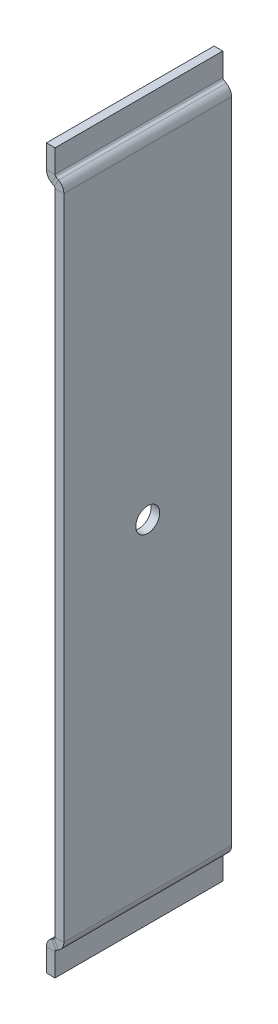
from build123d import *

# Parameters (mm, degrees)
BASE_FLANGE1_DEPTH = 44.45
CUT_EXTRUDE3_REACH = 107.213
SKETCH5_R          = 3.175


# Sheet-metal steps are written as plain solids
with BuildPart() as part:
    # Sketch1 → Base-Flange1 (new body)
    with BuildSketch(Plane.XY):
        with BuildLine():
            Line((-2.3368, 95.25), (-2.3368, 89.163964543))
            ThreePointArc((-2.3368, 89.163964543), (-1.962474978, 87.766964543), (-0.9398, 86.744289565))
            Line((-0.9398, 86.744289565), (-0.254, 86.34834275))
            ThreePointArc((-0.254, 86.34834275), (-0.068059095, 86.162401845), (0, 85.908401845))
            Line((0, 85.908401845), (0, -85.908401845))
            ThreePointArc((0, -85.908401845), (-0.068059095, -86.162401845), (-0.254, -86.34834275))
            Line((-0.254, -86.34834275), (-0.9398, -86.744289565))
            ThreePointArc((-0.9398, -86.744289565), (-1.962474978, -87.766964543), (-2.3368, -89.163964543))
            Line((-2.3368, -89.163964543), (-2.3368, -95.25))
            Line((-2.3368, -95.25), (-0.0508, -95.25))
            Line((-0.0508, -95.25), (-0.0508, -89.163964543))
            ThreePointArc((-0.0508, -89.163964543), (0.017259095, -88.909964543), (0.2032, -88.724023638))
            Line((0.2032, -88.724023638), (0.889, -88.328076823))
            ThreePointArc((0.889, -88.328076823), (1.911674978, -87.305401845), (2.286, -85.908401845))
            Line((2.286, -85.908401845), (2.286, 85.908401845))
            ThreePointArc((2.286, 85.908401845), (1.911674978, 87.305401845), (0.889, 88.328076823))
            Line((0.889, 88.328076823), (0.2032, 88.724023638))
            ThreePointArc((0.2032, 88.724023638), (0.017259095, 88.909964543), (-0.0508, 89.163964543))
            Line((-0.0508, 89.163964543), (-0.0508, 95.25))
            Line((-0.0508, 95.25), (-2.3368, 95.25))
        make_face()
    extrude(amount=BASE_FLANGE1_DEPTH)

    # Sketch5 → Cut-Extrude3 (cut, up to next)
    with BuildSketch(Plane(origin=(2.286, 0, 0), x_dir=(0, 0, -1), z_dir=(1, 0, 0)), mode=Mode.PRIVATE) as cut_extrude3_sk1:
        with Locations(Location((-22.225, 0, 0), (0, 0, 90))):
            Circle(SKETCH5_R)
    cut_extrude3_tool1 = extrude(cut_extrude3_sk1.sketch, amount=-CUT_EXTRUDE3_REACH, mode=Mode.PRIVATE) & part.part
    add(cut_extrude3_tool1.solids().sort_by_distance((2.286, 0, 22.225))[0], mode=Mode.SUBTRACT)


solid = part.part
